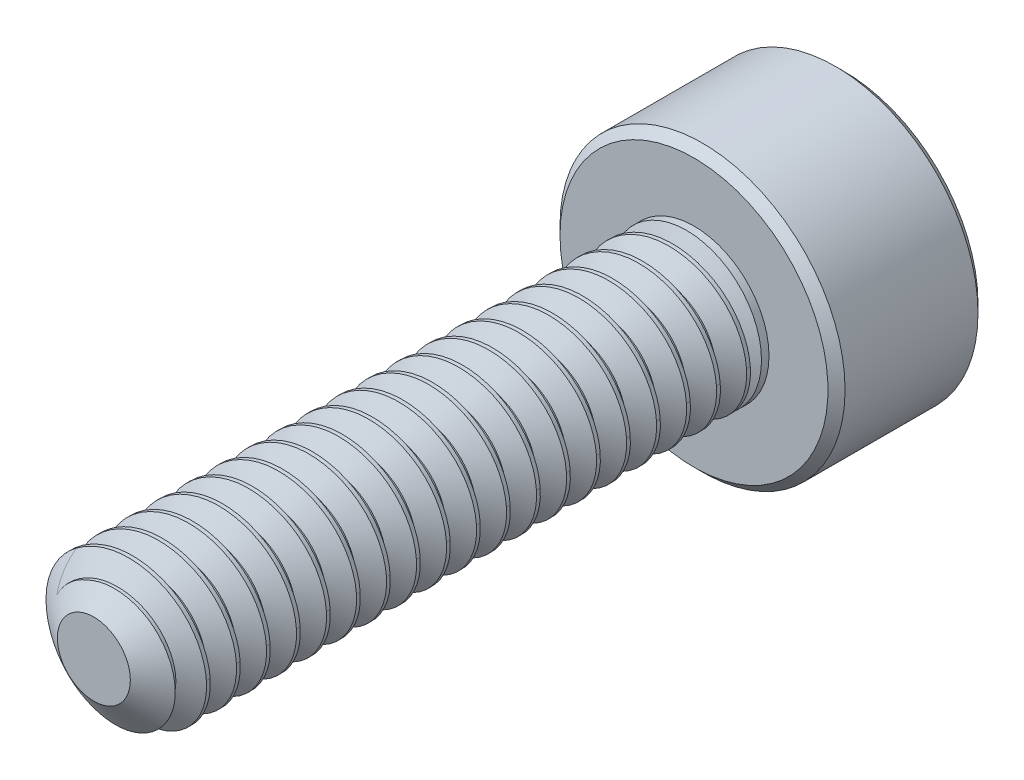
from build123d import *

# Parameters (mm, degrees)
SKETCH1_R          = 1
EXTRUDE1_DEPTH     = 8
CUT_SWEEP1_PITCH   = 0.4
SKETCH6_R          = 1.9
EXTRUDE2_DEPTH     = 2
CUT_EXTRUDE1_DEPTH = 1.125
CHAMFER1_SIZE      = 0.114


with BuildPart() as part:
    # Sketch1 → Extrude1 (new body)
    with BuildSketch(Plane.XY):
        Circle(SKETCH1_R)
    extrude(amount=-EXTRUDE1_DEPTH)

    # Cut-Sweep1: the profile of Sketch3 profile screwed along a right-hand helix of 21 turns, 6 arcs to a turn; built about Z, then put on its axis
    cut_sweep1_z = Axis((0, 0, 0), (0, 0, 1))
    cut_sweep1_corners = [(1.0003, 0, -0.350173205), (0.740192379, 0, -0.2), (0.740192379, 0, -0.15), (1.0003, 0, 0.000173205)]
    with BuildLine(mode=Mode.PRIVATE) as cut_sweep1_profile:
        Line(cut_sweep1_corners[0], cut_sweep1_corners[1])
        Line(cut_sweep1_corners[1], cut_sweep1_corners[2])
        Line(cut_sweep1_corners[2], cut_sweep1_corners[3])
        Line(cut_sweep1_corners[3], cut_sweep1_corners[0])
    cut_sweep1_cap = Face(cut_sweep1_profile.wire())
    cut_sweep1_turn_angles = [0, 30, 60, 90, 120, 150, 180, 210, 240, 270, 300, 330, 360]
    cut_sweep1_turn_weights = [1, 0.8660254037844387, 1, 0.8660254037844387, 1, 0.8660254037844387, 1, 0.8660254037844387, 1, 0.8660254037844387, 1, 0.8660254037844387, 1]
    cut_sweep1_turn_rails = [Edge.make_bspline([Vector(p[0], p[1], 0).rotate(cut_sweep1_z, cut_sweep1_turn_angles[k]) / cut_sweep1_turn_weights[k] + Vector(0, 0, p[2] + CUT_SWEEP1_PITCH * cut_sweep1_turn_angles[k] / 360) for k in range(13)], [0, 0, 0, 1, 1, 2, 2, 3, 3, 4, 4, 5, 5, 6, 6, 6], 2, cut_sweep1_turn_weights) for p in cut_sweep1_corners]
    cut_sweep1_turn_sides = [Face.make_surface_from_curves(cut_sweep1_turn_rails[p[0]], cut_sweep1_turn_rails[p[1]]) for p in [(0, 1), (1, 2), (2, 3), (3, 0)]]
    cut_sweep1 = Plane(origin=(0, 0, 0), x_dir=(0, 1, 0), z_dir=(0, 0, -1)) * Solid(Shell([*[p.moved(Location((0, 0, CUT_SWEEP1_PITCH * i))) for i in range(21) for p in cut_sweep1_turn_sides], cut_sweep1_cap, cut_sweep1_cap.rotate(cut_sweep1_z, 7560).moved(Location((0, 0, CUT_SWEEP1_PITCH * 7560 / 360)))]))
    add(cut_sweep1, mode=Mode.SUBTRACT)

    # Sketch4 → Cut-Revolve1 (revolve, cut)
    with BuildSketch(Plane(origin=(0, 0, 0), x_dir=(0, 0, -1), z_dir=(1, 0, 0)), mode=Mode.PRIVATE) as cut_revolve1_sk:
        Polygon((0.35977197, 1), (0, 0.486192379), (0, 1), align=None)
    revolve(cut_revolve1_sk.sketch.rotate(Axis((0, 0, 0), (0, 0, -1)), 278.428757723), axis=Axis((0, 0, 0), (0, 0, -1)), mode=Mode.SUBTRACT)

    # Sketch6 → Extrude2 (add)
    with BuildSketch(Plane(origin=(0, 0, -8), x_dir=(-1, 0, 0), z_dir=(0, 0, -1))):
        Circle(SKETCH6_R)
    extrude(amount=EXTRUDE2_DEPTH)

    # Sketch7 → Cut-Extrude1 (cut)
    with BuildSketch(Plane(origin=(0, 0, -10), x_dir=(-1, 0, 0), z_dir=(0, 0, -1))):
        Polygon((0, 0.866025404), (-0.75, 0.433012702), (-0.75, -0.433012702), (0, -0.866025404), (0.75, -0.433012702), (0.75, 0.433012702), align=None)
    extrude(amount=-CUT_EXTRUDE1_DEPTH, mode=Mode.SUBTRACT)

    # Cut-Extrude2 cone 1 section (through the dimple's axis) → Cut-Extrude2 (revolve, cut)
    with BuildSketch(Plane(origin=(0, 0, -10), x_dir=(0, 1, 0), z_dir=(1, 0, 0))):
        Polygon((0, 0), (0.866025404, 0), (0, 0.866025404), align=None)
    revolve(axis=Axis((0, 0, -10), (0, 0, 1)), mode=Mode.SUBTRACT)

    # Chamfer1
    chamfer1_edges = [part.edges().sort_by_distance(p)[0] for p in [
        (1.9, 0, -8),
        (1.9, 0, -10),
    ]]
    chamfer(chamfer1_edges, length=CHAMFER1_SIZE)

    # Sketch10 → Revolve1 (revolve)
    with BuildSketch(Plane(origin=(0, 0, 0), x_dir=(0, 0, -1), z_dir=(1, 0, 0)), mode=Mode.PRIVATE) as revolve1_sk:
        Polygon((8, 1), (8, 0), (7.485786438, 0), (7.9, 1), align=None)
    revolve(revolve1_sk.sketch.rotate(Axis((0, 0, -8), (0, 0, 1)), 270), axis=Axis((0, 0, -8), (0, 0, 1)))


solid = part.part
